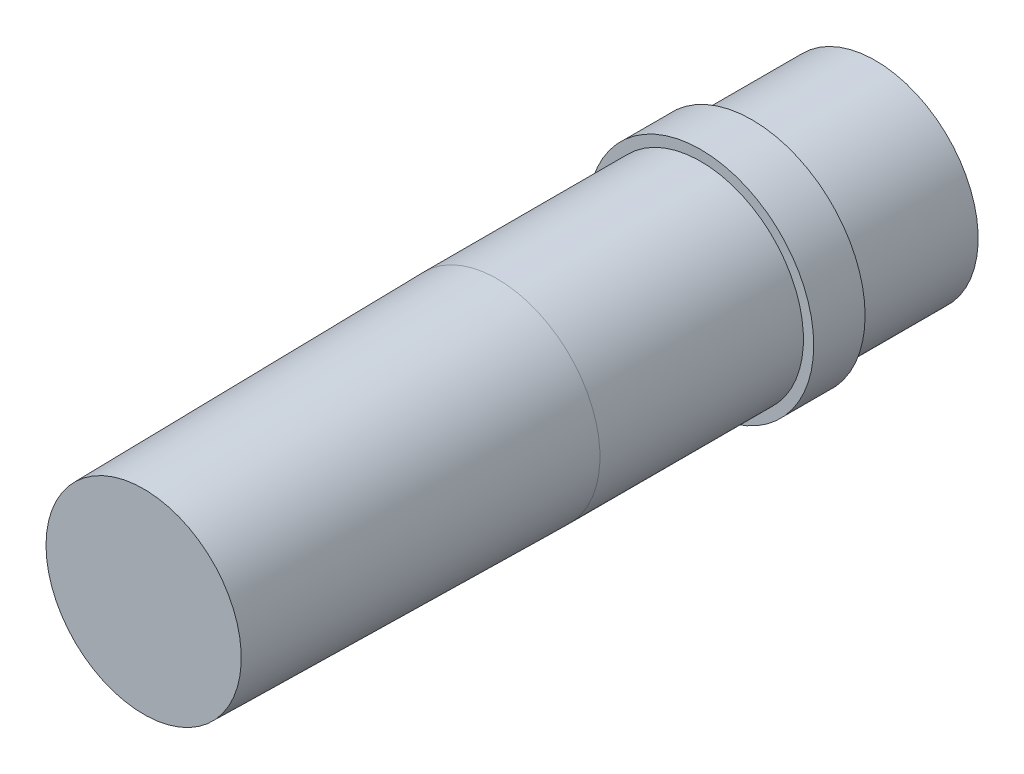
from build123d import *

# Parameters (mm, degrees)
SKETCH2_R          = 0.425
CUT_EXTRUDE1_DEPTH = 1.5


with BuildPart() as part:
    # Sketch1 → Revolve1 (revolve)
    with BuildSketch(Plane(origin=(0, 0, 0), x_dir=(1, 0, 0), z_dir=(0, 1, 0))):
        Polygon((0, 3.56), (-0.5, 3.56), (-0.5, 2.96), (-0.55, 2.96), (-0.55, 2.71), (-0.5, 2.71), (-0.5, 1.72), (-0.475, 0), (0, 0), align=None)
    revolve(axis=Axis((0, 0, -1.599810873), (0, 0, 1)))

    # Sketch2 → Cut-Extrude1 (cut)
    with BuildSketch(Plane(origin=(0, 0, -3.56), x_dir=(-1, 0, 0), z_dir=(0, 0, -1))):
        Circle(SKETCH2_R)
    extrude(amount=-CUT_EXTRUDE1_DEPTH, mode=Mode.SUBTRACT)


solid = part.part
